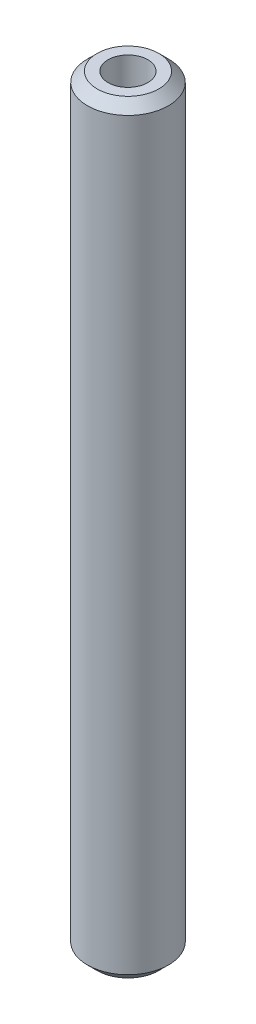
from build123d import *

# Parameters (mm, degrees)
SKETCH1_R           = 5
BOSS_EXTRUDE1_DEPTH = 94.205987138
SKETCH2_R           = 2.453733579
CUT_EXTRUDE1_DEPTH  = 95.470990323
CHAMFER1_SIZE       = 1.197231577


with BuildPart() as part:
    # Sketch1 → Boss-Extrude1 (new body)
    with BuildSketch(Plane(origin=(0, 0, 0), x_dir=(1, 0, 0), z_dir=(0, 1, 0))):
        Circle(SKETCH1_R)
    extrude(amount=BOSS_EXTRUDE1_DEPTH)

    # Sketch2 → Cut-Extrude1 (cut, through all)
    with BuildSketch(Plane(origin=(0, 0, 0), x_dir=(1, 0, 0), z_dir=(0, 1, 0))):
        Circle(SKETCH2_R)
    extrude(amount=CUT_EXTRUDE1_DEPTH, mode=Mode.SUBTRACT)

    # Chamfer1
    chamfer1_edges = [part.edges().sort_by_distance(p)[0] for p in [
        (-5, 94.205987138, 0),
        (-5, 0, 0),
    ]]
    chamfer(chamfer1_edges, length=CHAMFER1_SIZE)


solid = part.part
